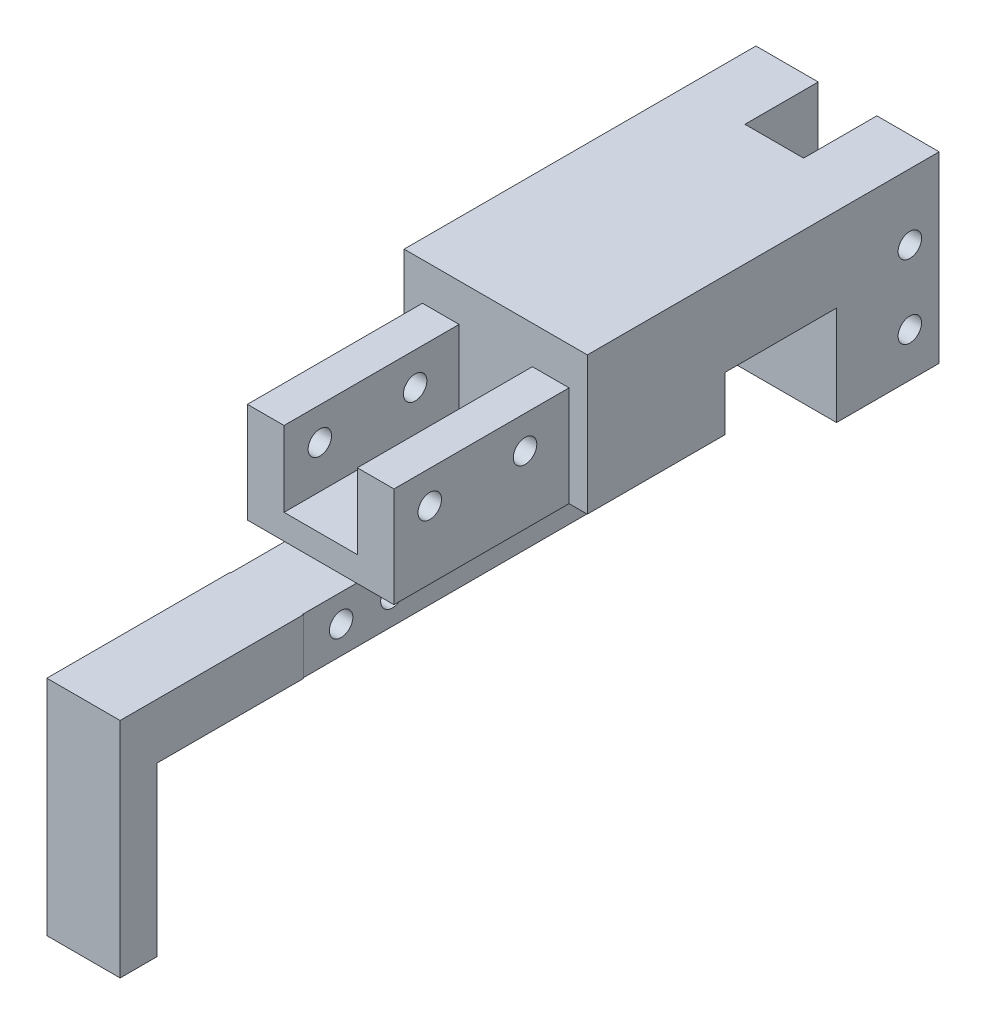
from build123d import *

# Parameters (mm, degrees)
SKETCH_2_W          = 50
SKETCH_2_H          = 7.55
SKETCH_2_R          = 1.6
EXTRUDE_1_DEPTH     = 4.9
SKETCH_3_W          = 23.885574904
SKETCH_3_H          = 13.680093874
SKETCH_3_R          = 1.6
EXTRUDE_2_DEPTH     = 10
SKETCH_4_W          = 10
SKETCH_4_H          = 10.264550668
CUT_EXTRUDE_1_DEPTH = 48.143107127
SKETCH_6_W          = 14
SKETCH_6_H          = 25
SKETCH_6_R          = 1.6
EXTRUDE_4_DEPTH     = 12.5
SKETCH_7_W          = 8
SKETCH_7_H          = 25
CUT_EXTRUDE_2_DEPTH = 10
EXTRUDE_5_DEPTH     = 12.5
EXTRUDE_6_DEPTH     = 5


with BuildPart() as part:
    # 草图2 → 凸台-拉伸1 (new, symmetric)
    with BuildSketch(Plane(origin=(0, 0, 0), x_dir=(0, 0, -1), z_dir=(1, 0, 0))):
        with Locations((19.75, 0)):
            Rectangle(SKETCH_2_W, SKETCH_2_H)
        Circle(SKETCH_2_R, mode=Mode.SUBTRACT)
        with Locations((7, 0)):
            Circle(SKETCH_2_R, mode=Mode.SUBTRACT)
        with Locations((32.5, 0)):
            Circle(SKETCH_2_R, mode=Mode.SUBTRACT)
        with Locations((39.5, 0)):
            Circle(SKETCH_2_R, mode=Mode.SUBTRACT)
    extrude(amount=EXTRUDE_1_DEPTH, both=True)

    # 草图3 → 凸台-拉伸2 (add, symmetric)
    with BuildSketch(Plane(origin=(0, 0, 0), x_dir=(0, 0, -1), z_dir=(1, 0, 0))):
        with Locations((14.057212548, 10.615046937)):
            Rectangle(SKETCH_3_W, SKETCH_3_H)
        with Locations((7, 13)):
            Circle(SKETCH_3_R, mode=Mode.SUBTRACT)
        with Locations((20, 13)):
            Circle(SKETCH_3_R, mode=Mode.SUBTRACT)
    extrude(amount=EXTRUDE_2_DEPTH, both=True)

    # 草图4 → 切除-拉伸1 (cut, through all)
    with BuildSketch(Plane.XY.offset(-2.114425096)):
        with Locations((0, 12.32281854)):
            Rectangle(SKETCH_4_W, SKETCH_4_H)
    extrude(amount=-CUT_EXTRUDE_1_DEPTH, mode=Mode.SUBTRACT)



with BuildPart() as body_2:
    # 草图6 → 凸台-拉伸4 (new, symmetric)
    with BuildSketch(Plane(origin=(0, 0, 0), x_dir=(0, 0, -1), z_dir=(1, 0, 0))):
        with Locations((67, 10.1)):
            Rectangle(SKETCH_6_W, SKETCH_6_H)
        with Locations((70, 3.6)):
            Circle(SKETCH_6_R, mode=Mode.SUBTRACT)
        with Locations((70, 13.6)):
            Circle(SKETCH_6_R, mode=Mode.SUBTRACT)
    extrude(amount=EXTRUDE_4_DEPTH, both=True)

    # 草图7 → 切除-拉伸2 (cut)
    with BuildSketch(Plane.XY.offset(-74)):
        with Locations((0, 10.1)):
            Rectangle(SKETCH_7_W, SKETCH_7_H)
    extrude(amount=CUT_EXTRUDE_2_DEPTH, mode=Mode.SUBTRACT)


with BuildPart() as part_1:
    add(part.part)

    add(body_2.part)  # 凸台-拉伸5 merges body 2
    # 草图8 → 凸台-拉伸5 (add, symmetric)
    with BuildSketch(Plane(origin=(0, 0, 0), x_dir=(0, 0, -1), z_dir=(1, 0, 0))):
        Polygon((60, 22.6), (26, 22.6), (26, 11.139938787), (26, 3.775), (44.75, 3.775), (44.75, 11.139938787), (60, 11.139938787), align=None)
    extrude(amount=EXTRUDE_5_DEPTH, both=True)

    # 草图10 → 凸台-拉伸6 (add, symmetric)
    with BuildSketch(Plane(origin=(0, 0, 0), x_dir=(0, 0, -1), z_dir=(1, 0, 0))):
        Polygon((-5.25, 3.775), (-5.25, -3.775), (-25.25, -3.775), (-25.25, -26.653859508), (-30.25, -26.653859508), (-30.25, 3.775), align=None)
    extrude(amount=EXTRUDE_6_DEPTH, both=True)


solid = part_1.part
